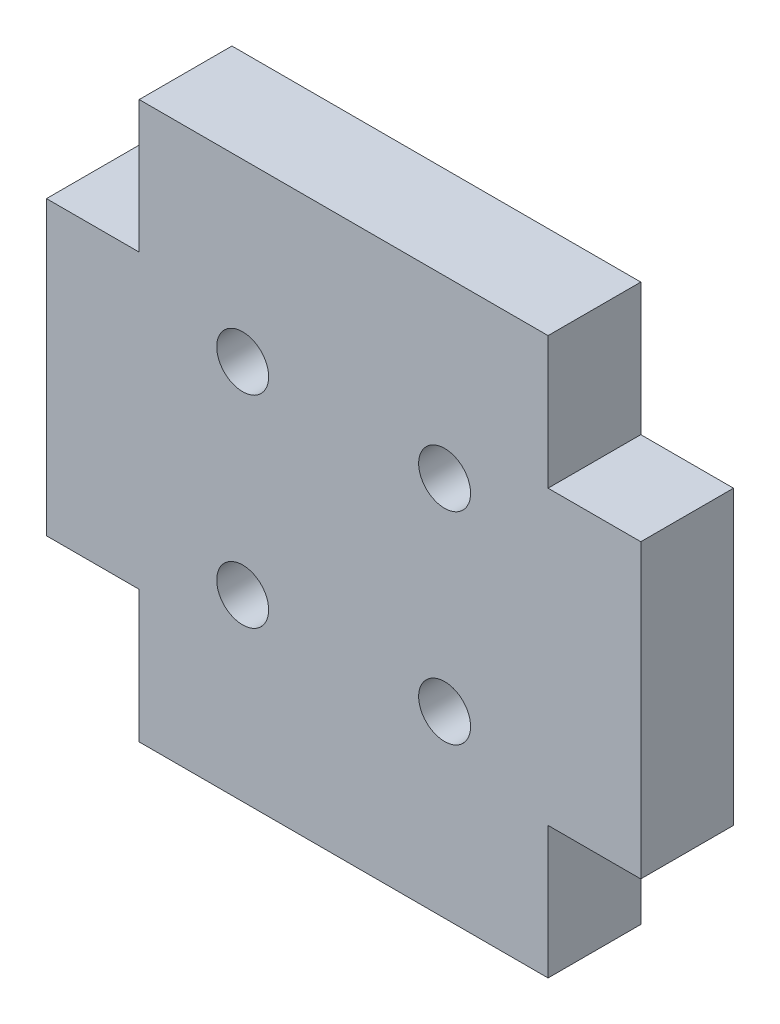
from build123d import *

# Parameters (mm, degrees)
BOSS_EXTRU_1_DEPTH      = 6.35
ENL_V_MAT_EXTRU_1_REACH = 30.589
ESQUISSE2_R             = 1.778


with BuildPart() as part:
    # Esquisse1 → Boss.-Extru.1 (new body)
    with BuildSketch(Plane.XY):
        Polygon((14, 19.05), (-14, 19.05), (-14, 10), (-20.35, 10), (-20.35, -10), (-14, -10), (-14, -19.05), (14, -19.05), (14, -10), (20.35, -10), (20.35, 10), (14, 10), align=None)
    extrude(amount=BOSS_EXTRU_1_DEPTH)

    # Esquisse2 → Enlèv. mat.-Extru.1 (cut, up to next)
    with BuildSketch(Plane.XY.offset(6.35), mode=Mode.PRIVATE) as enl_v_mat_extru_1_sk1:
        with Locations((-6.914797213, 7.041797213)):
            Circle(ESQUISSE2_R)
    enl_v_mat_extru_1_tool1 = extrude(enl_v_mat_extru_1_sk1.sketch, amount=-ENL_V_MAT_EXTRU_1_REACH, mode=Mode.PRIVATE) & part.part
    # Esquisse2 → Enlèv. mat.-Extru.1 (cut, up to next)
    with BuildSketch(Plane.XY.offset(6.35), mode=Mode.PRIVATE) as enl_v_mat_extru_1_sk2:
        with Locations((6.914797213, 7.041797213)):
            Circle(ESQUISSE2_R)
    enl_v_mat_extru_1_tool2 = extrude(enl_v_mat_extru_1_sk2.sketch, amount=-ENL_V_MAT_EXTRU_1_REACH, mode=Mode.PRIVATE) & part.part
    # Esquisse2 → Enlèv. mat.-Extru.1 (cut, up to next)
    with BuildSketch(Plane.XY.offset(6.35), mode=Mode.PRIVATE) as enl_v_mat_extru_1_sk3:
        with Locations((6.914797213, -6.787797213)):
            Circle(ESQUISSE2_R)
    enl_v_mat_extru_1_tool3 = extrude(enl_v_mat_extru_1_sk3.sketch, amount=-ENL_V_MAT_EXTRU_1_REACH, mode=Mode.PRIVATE) & part.part
    # Esquisse2 → Enlèv. mat.-Extru.1 (cut, up to next)
    with BuildSketch(Plane.XY.offset(6.35), mode=Mode.PRIVATE) as enl_v_mat_extru_1_sk4:
        with Locations((-6.914797213, -6.787797213)):
            Circle(ESQUISSE2_R)
    enl_v_mat_extru_1_tool4 = extrude(enl_v_mat_extru_1_sk4.sketch, amount=-ENL_V_MAT_EXTRU_1_REACH, mode=Mode.PRIVATE) & part.part
    add(enl_v_mat_extru_1_tool1.solids().sort_by_distance((-6.914797, 7.041797, 6.35))[0], mode=Mode.SUBTRACT)
    add(enl_v_mat_extru_1_tool2.solids().sort_by_distance((6.914797, 7.041797, 6.35))[0], mode=Mode.SUBTRACT)
    add(enl_v_mat_extru_1_tool3.solids().sort_by_distance((6.914797, -6.787797, 6.35))[0], mode=Mode.SUBTRACT)
    add(enl_v_mat_extru_1_tool4.solids().sort_by_distance((-6.914797, -6.787797, 6.35))[0], mode=Mode.SUBTRACT)


solid = part.part
